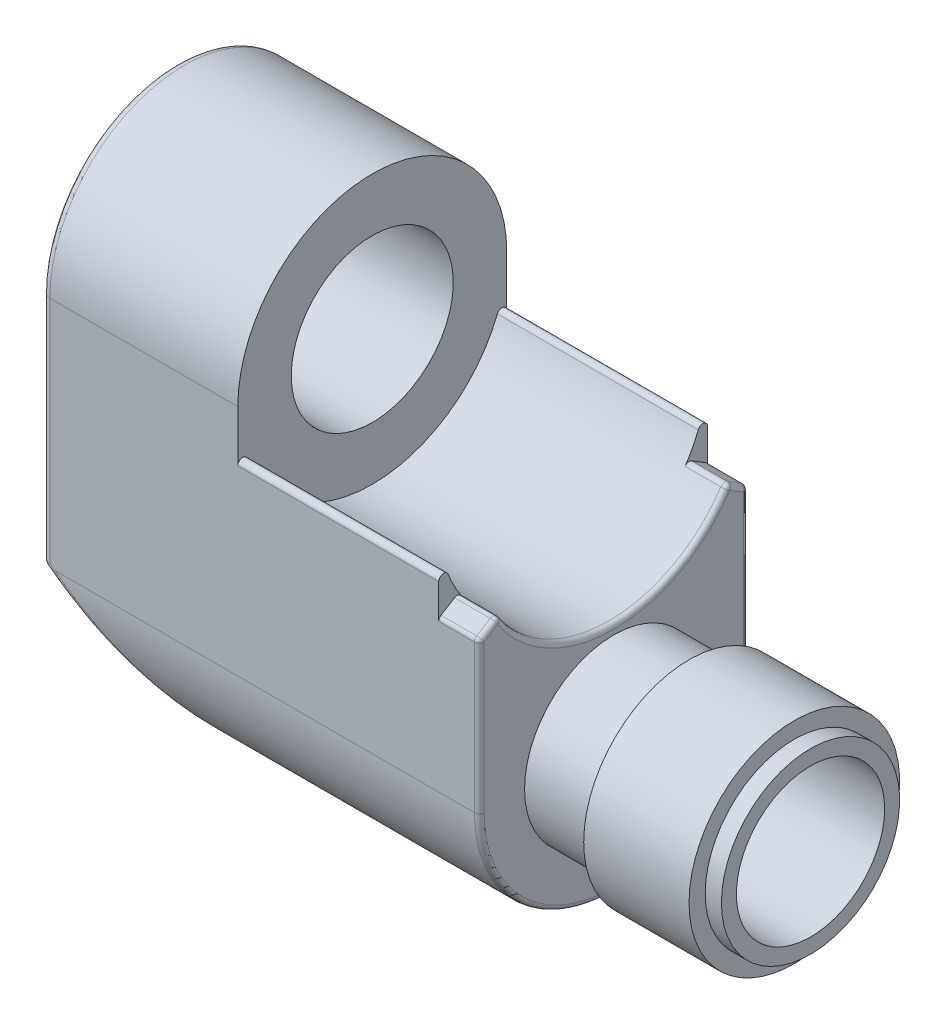
from build123d import *

# Parameters (mm, degrees)
BOSS_EXTRUDE1_DEPTH     = 68.58
CUT_EXTRUDE1_START      = -6.35
SKETCH2_R               = 21.082
CUT_EXTRUDE1_DEPTH      = 6.35
CUT_EXTRUDE2_START      = -6.35
CUT_EXTRUDE2_DEPTH      = 6.35
CUT_EXTRUDE3_DEPTH      = 93.044076876
CUT_EXTRUDE3_DEPTH_BACK = 93.044076876
FILLET1_R               = 1.27
CUT_EXTRUDE6_START      = 31.496
SKETCH8_R               = 21.082
CUT_EXTRUDE6_DEPTH      = 31.496
SKETCH9_R               = 12.7
CUT_EXTRUDE7_DEPTH      = 117.864914259
FILLET7_R               = 1.27
FILLET8_START           = 30.734
FILLET8_DEPTH           = 31.496
FILLET9_R               = 0.762
FILLET10_R              = 0.762
SKETCH10_R              = 11.6205
CUT_EXTRUDE8_DEPTH      = 29.718
SKETCH11_R              = 9.2075
CUT_EXTRUDE9_DEPTH      = 42.418


with BuildPart() as part:
    # Sketch1 → Boss-Extrude1 (new body)
    with BuildSketch(Plane(origin=(0, 0, 0), x_dir=(0, 0, -1), z_dir=(1, 0, 0))):
        with BuildLine():
            Line((-21.082, 0), (-21.082, -36.576))
            ThreePointArc((-21.082, -36.576), (0, -57.658), (21.082, -36.576))
            Line((21.082, -36.576), (21.082, 0))
            ThreePointArc((21.082, 0), (0, 21.082), (-21.082, 0))
        make_face()
    extrude(amount=BOSS_EXTRUDE1_DEPTH)

    # Sketch2 → Cut-Extrude1 (cut)
    with BuildSketch(Plane(origin=(68.58, 0, 0), x_dir=(0, 0, -1), z_dir=(1, 0, 0)).offset(CUT_EXTRUDE1_START)):
        Circle(SKETCH2_R)
    extrude(amount=CUT_EXTRUDE1_DEPTH, mode=Mode.SUBTRACT)

    # Sketch3 → Cut-Extrude2 (cut)
    with BuildSketch(Plane(origin=(68.58, 0, 0), x_dir=(0, 0, -1), z_dir=(1, 0, 0)).offset(CUT_EXTRUDE2_START)):
        with BuildLine():
            Line((-21.082, 0), (-21.082, -12.967513736))
            Line((-21.082, -12.967513736), (-17.956950774, -11.045299584))
            ThreePointArc((-17.956950774, -11.045299584), (-20.285698906, -5.739437593), (-21.082, 0))
        make_face()
    cut_extrude2 = extrude(amount=CUT_EXTRUDE2_DEPTH, mode=Mode.SUBTRACT)

    # Mirror2: Cut-Extrude2 across plane
    add(cut_extrude2.mirror(Plane.XY), mode=Mode.SUBTRACT)

    # Sketch4 → Cut-Extrude3 (cut, two sides: drawn at the far end of the back side and taken through both)
    with BuildSketch(Plane.XY.offset(-CUT_EXTRUDE3_DEPTH_BACK)):
        Polygon((0, -36.576), (28.194, -57.658), (0, -57.658), align=None)
    extrude(amount=CUT_EXTRUDE3_DEPTH + CUT_EXTRUDE3_DEPTH_BACK, mode=Mode.SUBTRACT)

    # Sketch5 → Revolve1 (revolve)
    with BuildSketch(Plane.XY, mode=Mode.PRIVATE) as revolve1_sk:
        Polygon((68.58, -50.546), (80.391, -50.546), (80.391, -53.086), (96.901, -53.086), (96.901, -50.546), (99.441, -50.546), (99.441, -36.576), (68.58, -36.576), align=None)
    revolve(revolve1_sk.sketch.rotate(Axis((68.58, -36.576, 0), (1, 0, 0)), 270), axis=Axis((68.58, -36.576, 0), (1, 0, 0)))

    # Fillet1
    fillet1_edges = [part.edges().sort_by_distance(p)[0] for p in [
        (0, -36.576, 0),
    ]]
    fillet(fillet1_edges, radius=FILLET1_R)

    # Sketch8 → Cut-Extrude6 (cut)
    with BuildSketch(Plane.ZY.offset(-62.23).offset(CUT_EXTRUDE6_START)):
        Circle(SKETCH8_R)
    extrude(amount=-CUT_EXTRUDE6_DEPTH, mode=Mode.SUBTRACT)

    # Sketch9 → Cut-Extrude7 (cut, through all)
    with BuildSketch(Plane.ZY):
        Circle(SKETCH9_R)
    extrude(amount=-CUT_EXTRUDE7_DEPTH, mode=Mode.SUBTRACT)

    # Fillet7
    fillet7_edges = [part.edges().sort_by_distance(p)[0] for p in [
        (0, -17.969927102, 21.082),
        (0, 21.082, 0),
        (0, -17.969927102, -21.082),
        (0.043445634, -36.269193524, 21.082),
        (17.697322345, -49.809132924, 16.411426416),
        (0.320832952, -36.783644414, -21.080977392),
        (0.320832952, -36.783644414, 21.080977392),
        (0.043445634, -36.269193524, -21.082),
    ]]
    fillet(fillet7_edges, radius=FILLET7_R)

    # Fillet8: read off the stored shape, not the designer's step
    # Fillet8 outline → Fillet8 (cut)
    with BuildSketch(Plane.YZ.offset(FILLET8_START)):
        with BuildLine():
            ThreePointArc((-8.01610479, 21.082), (-7.267513461, 20.462320144), (-7.736473227, 19.611162791))
            ThreePointArc((-7.736473227, 19.611162791), (-3.937523971, 20.711026749), (0, 21.082))
            Line((0, 21.082), (-8.01610479, 21.082))
        make_face()
        with BuildLine():
            ThreePointArc((-7.736473227, -19.611162791), (-7.267513461, -20.462320144), (-8.01610479, -21.082))
            Line((-8.01610479, -21.082), (0, -21.082))
            ThreePointArc((0, -21.082), (-3.937523971, -20.711026749), (-7.736473227, -19.611162791))
        make_face()
    extrude(amount=FILLET8_DEPTH, mode=Mode.SUBTRACT)

    # Fillet9
    fillet9_edges = [part.edges().sort_by_distance(p)[0] for p in [
        (65.405, -11.045299584, 17.956950774),
        (65.405, -12.967513736, 21.082),
        (65.405, -12.967513736, -21.082),
        (65.405, -11.045299584, -17.956950774),
    ]]
    fillet(fillet9_edges, radius=FILLET9_R)

    # Fillet10
    fillet10_edges = [part.edges().sort_by_distance(p)[0] for p in [
        (68.58, -57.658, 0),
        (68.58, -24.984709663, -21.082),
        (68.58, -12.090967399, -19.65695043),
        (68.58, -21.082, 0),
        (68.58, -12.090967399, 19.65695043),
        (68.58, -24.984709663, 21.082),
        (68.58, -13.021644868, 20.985152428),
        (68.58, -11.342397813, 18.031754442),
        (68.58, -11.342397813, -18.031754442),
        (68.58, -13.021644868, -20.985152428),
    ]]
    fillet(fillet10_edges, radius=FILLET10_R)

    # Sketch10 → Cut-Extrude8 (cut)
    with BuildSketch(Plane(origin=(99.441, 0, 0), x_dir=(0, 0, -1), z_dir=(1, 0, 0))):
        with Locations((0, -36.576)):
            Circle(SKETCH10_R)
    extrude(amount=-CUT_EXTRUDE8_DEPTH, mode=Mode.SUBTRACT)

    # Sketch11 → Cut-Extrude9 (cut)
    with BuildSketch(Plane(origin=(69.723, 0, 0), x_dir=(0, 0, -1), z_dir=(1, 0, 0))):
        with Locations((0, -36.576)):
            Circle(SKETCH11_R)
    extrude(amount=-CUT_EXTRUDE9_DEPTH, mode=Mode.SUBTRACT)


solid = part.part
